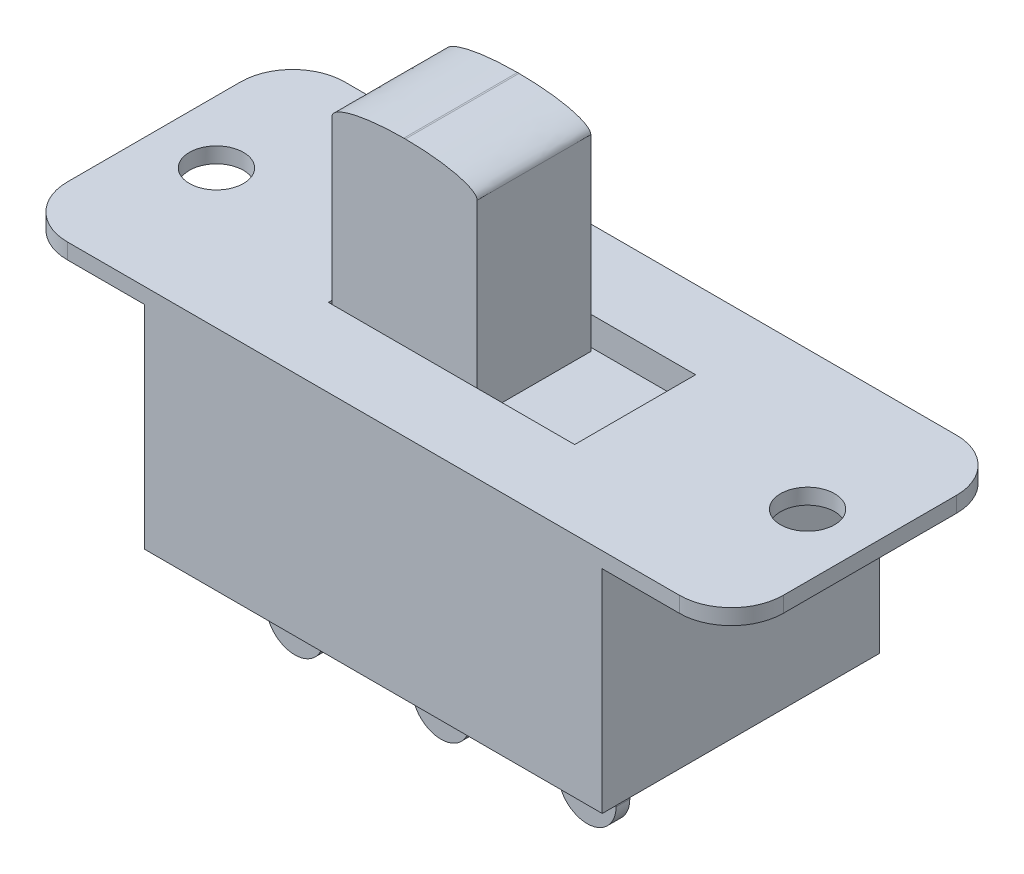
from build123d import *

# Parameters (mm, degrees)
BOSS_EXTRUDE1_DEPTH             = 0.762
SKETCH2_W                       = 22.352
SKETCH2_H                       = 13.5382
BOSS_EXTRUDE2_DEPTH             = 11.1125
SKETCH6_W                       = 12.0269
SKETCH6_H                       = 5.9055
CUT_EXTRUDE2_DEPTH              = 1.397
SKETCH3_W                       = 7.0866
SKETCH3_H                       = 5.5499
BOSS_EXTRUDE3_DEPTH             = 8.6106
BOSS_EXTRUDE3_DIRECTION_2_REACH = 41.105
FILLET4_SIZE                    = 3.5052
FILLET4_SIZE_2                  = 0.8382
SKETCH4_R                       = 1.318988248
CUT_EXTRUDE1_DEPTH              = 40.104844676
SKETCH5_W                       = 2.8194
SKETCH5_H                       = 0.6731
BOSS_EXTRUDE4_DEPTH             = 4.1021
FILLET5_RADIUS                  = 1.4097
FILLET5_LENGTH                  = 0.6731
FILLET6_RADIUS                  = 1.4097
FILLET6_LENGTH                  = 0.6731
FILLET7_RADIUS                  = 1.4097
FILLET7_LENGTH                  = 0.6731


with BuildPart() as part:
    # Sketch1 → Boss-Extrude1 (new body)
    with BuildSketch(Plane(origin=(0, 0, 0), x_dir=(1, 0, 0), z_dir=(0, 1, 0))):
        with BuildLine():
            Line((2.54, 0), (32.4231, 0))
            ThreePointArc((32.4231, 0), (34.219151224, 0.743948776), (34.9631, 2.54))
            Line((34.9631, 2.54), (34.9631, 10.9982))
            ThreePointArc((34.9631, 10.9982), (34.219151224, 12.794251224), (32.4231, 13.5382))
            Line((32.4231, 13.5382), (2.54, 13.5382))
            ThreePointArc((2.54, 13.5382), (0.743948776, 12.794251224), (0, 10.9982))
            Line((0, 10.9982), (0, 2.54))
            ThreePointArc((0, 2.54), (0.743948776, 0.743948776), (2.54, 0))
        make_face()
    extrude(amount=-BOSS_EXTRUDE1_DEPTH)

    # Sketch2 → Boss-Extrude2 (add)
    with BuildSketch(Plane(origin=(0, 0, 0), x_dir=(1, 0, 0), z_dir=(0, 1, 0))):
        with Locations((17.48155, 6.7691)):
            Rectangle(SKETCH2_W, SKETCH2_H)
    extrude(amount=-BOSS_EXTRUDE2_DEPTH)

    # Sketch6 → Cut-Extrude2 (cut)
    with BuildSketch(Plane(origin=(0, 0, 0), x_dir=(1, 0, 0), z_dir=(0, 1, 0))):
        with Locations((17.48155, 6.7691)):
            Rectangle(SKETCH6_W, SKETCH6_H)
    extrude(amount=-CUT_EXTRUDE2_DEPTH, mode=Mode.SUBTRACT)

    # Sketch3 → Boss-Extrude3 (add)
    with BuildSketch(Plane(origin=(0, 0, 0), x_dir=(1, 0, 0), z_dir=(0, 1, 0))):
        with Locations((15.0114, 6.7691)):
            Rectangle(SKETCH3_W, SKETCH3_H)
    extrude(amount=BOSS_EXTRUDE3_DEPTH)

    # Sketch3 → Boss-Extrude3 direction 2 (add, up to next)
    with BuildSketch(Plane(origin=(0, 0, 0), x_dir=(1, 0, 0), z_dir=(0, 1, 0)), mode=Mode.PRIVATE) as boss_extrude3_direction_2_sk1:
        with Locations((15.0114, 6.7691)):
            Rectangle(SKETCH3_W, SKETCH3_H)
    boss_extrude3_direction_2_tool1 = extrude(boss_extrude3_direction_2_sk1.sketch, amount=-BOSS_EXTRUDE3_DIRECTION_2_REACH, mode=Mode.PRIVATE) - part.part
    add(boss_extrude3_direction_2_tool1.solids().sort_by_distance((15.0114, 0, -6.7691))[0])

    # Fillet4
    # an asymmetric fillet: 3.5052, 0.8382 mm, written as the material it takes off along each edge
    with BuildSketch(Plane(origin=(18.5547, 8.6106, -18.30705), x_dir=(-1, 0, 0), z_dir=(0, 0, 1))) as fillet4_piece_1:
        with BuildLine():
            Bezier((FILLET4_SIZE, 0), (0, 0), (0, FILLET4_SIZE_2), weights=[1, 0.707106781, 1])
            Line((0, FILLET4_SIZE_2), (0, 0))
            Line((0, 0), (FILLET4_SIZE, 0))
        make_face()
    extrude(amount=23.0759, mode=Mode.SUBTRACT)
    with BuildSketch(Plane(origin=(11.4681, 8.6106, 4.76885), x_dir=(0, -1, 0), z_dir=(0, 0, -1))) as fillet4_piece_2:
        with BuildLine():
            Bezier((FILLET4_SIZE_2, 0), (0, 0), (0, -FILLET4_SIZE), weights=[1, 0.707106781, 1])
            Line((0, -FILLET4_SIZE), (0, 0))
            Line((0, 0), (FILLET4_SIZE_2, 0))
        make_face()
    extrude(amount=23.0759, mode=Mode.SUBTRACT)

    # Sketch4 → Cut-Extrude1 (cut, through all)
    with BuildSketch(Plane(origin=(0, 0, 0), x_dir=(1, 0, 0), z_dir=(0, 1, 0))):
        with Locations(Location((3.048, 6.7691, 0), (0, 0, 270))):
            Circle(SKETCH4_R)
        with Locations(Location((31.9151, 6.7691, 0), (0, 0, 270))):
            Circle(SKETCH4_R)
    extrude(amount=-CUT_EXTRUDE1_DEPTH, mode=Mode.SUBTRACT)

    # Sketch5 → Boss-Extrude4 (add)
    with BuildSketch(Plane.XZ.offset(11.1125)):
        with Locations((10.34415, -3.63855)):
            Rectangle(SKETCH5_W, SKETCH5_H)
        with Locations((17.48155, -3.63855)):
            Rectangle(SKETCH5_W, SKETCH5_H)
        with Locations((24.61895, -3.63855)):
            Rectangle(SKETCH5_W, SKETCH5_H)
    extrude(amount=BOSS_EXTRUDE4_DEPTH)

    # Fillet5: full round fillet: the end face becomes a half cylinder, R = half its width
    fillet5_face = Plane((10.34415, -15.2146, -3.63855), x_dir=(0, 0, -1), z_dir=(0, -1, 0))  # on the end face: x along it, z out of the body
    fillet5_slab = fillet5_face.offset(-FILLET5_RADIUS / 2) * Box(FILLET5_LENGTH, 2 * FILLET5_RADIUS, FILLET5_RADIUS, mode=Mode.PRIVATE)  # the body's end, R deep
    fillet5_round = Plane((10.34415, -13.8049, -3.63855), x_dir=(0, -1, 0), z_dir=(0, 0, -1)) * Cylinder(FILLET5_RADIUS, FILLET5_LENGTH, mode=Mode.PRIVATE)  # its axis R under the face
    add(fillet5_slab - fillet5_round, mode=Mode.SUBTRACT)

    # Fillet6: full round fillet: the end face becomes a half cylinder, R = half its width
    fillet6_face = Plane((17.48155, -15.2146, -3.63855), x_dir=(0, 0, -1), z_dir=(0, -1, 0))  # on the end face: x along it, z out of the body
    fillet6_slab = fillet6_face.offset(-FILLET6_RADIUS / 2) * Box(FILLET6_LENGTH, 2 * FILLET6_RADIUS, FILLET6_RADIUS, mode=Mode.PRIVATE)  # the body's end, R deep
    fillet6_round = Plane((17.48155, -13.8049, -3.63855), x_dir=(0, -1, 0), z_dir=(0, 0, -1)) * Cylinder(FILLET6_RADIUS, FILLET6_LENGTH, mode=Mode.PRIVATE)  # its axis R under the face
    add(fillet6_slab - fillet6_round, mode=Mode.SUBTRACT)

    # Fillet7: full round fillet: the end face becomes a half cylinder, R = half its width
    fillet7_face = Plane((24.61895, -15.2146, -3.63855), x_dir=(0, 0, -1), z_dir=(0, -1, 0))  # on the end face: x along it, z out of the body
    fillet7_slab = fillet7_face.offset(-FILLET7_RADIUS / 2) * Box(FILLET7_LENGTH, 2 * FILLET7_RADIUS, FILLET7_RADIUS, mode=Mode.PRIVATE)  # the body's end, R deep
    fillet7_round = Plane((24.61895, -13.8049, -3.63855), x_dir=(0, -1, 0), z_dir=(0, 0, -1)) * Cylinder(FILLET7_RADIUS, FILLET7_LENGTH, mode=Mode.PRIVATE)  # its axis R under the face
    add(fillet7_slab - fillet7_round, mode=Mode.SUBTRACT)


solid = part.part
